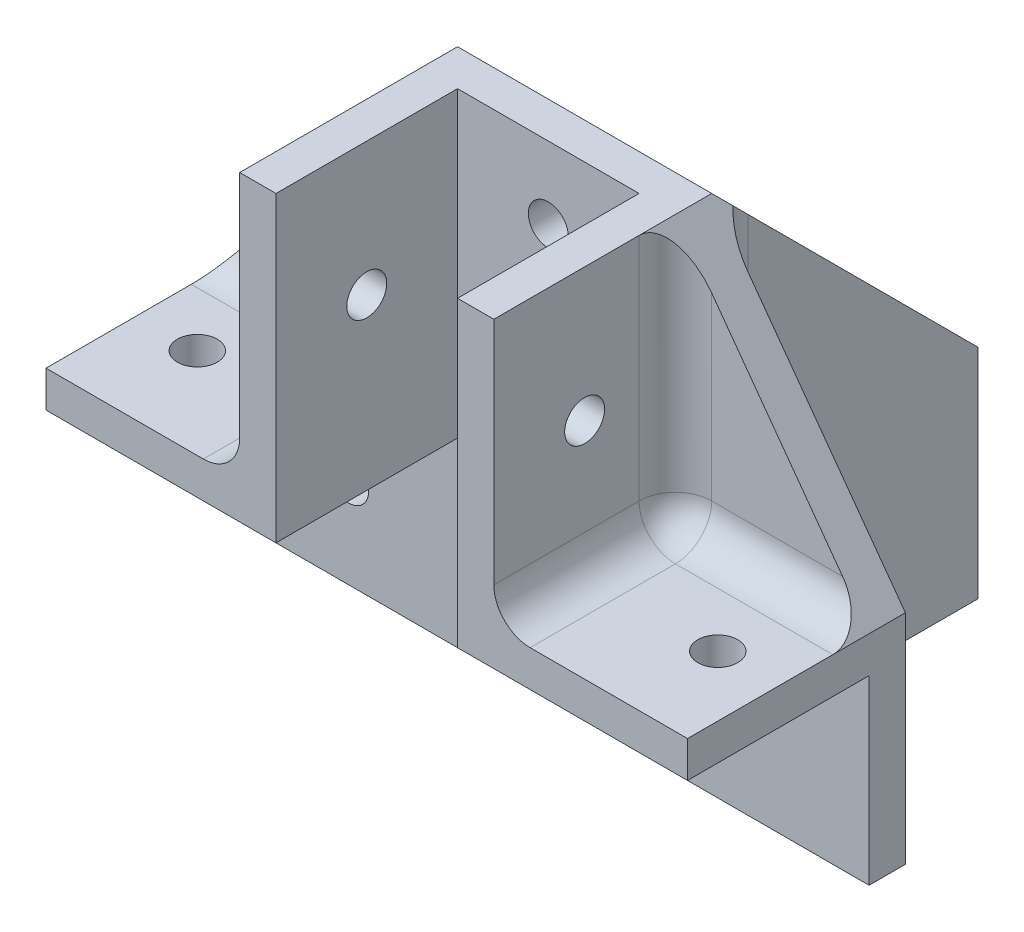
from build123d import *

# Parameters (mm, degrees)
EXTRUDE_1_DEPTH     = 18
SKETCH_2_W          = 21
SKETCH_2_H          = 18
EXTRUDE_2_DEPTH     = 22
SKETCH_3_W          = 15
SKETCH_3_H          = 15
CUT_EXTRUDE_1_DEPTH = 74.280283842
SKETCH_4_W          = 15
SKETCH_4_H          = 15
CUT_EXTRUDE_2_DEPTH = 58.124863238
SKETCH_5_W          = 15
SKETCH_5_H          = 15
CUT_EXTRUDE_3_DEPTH = 63.467991804
SKETCH_6_R          = 1.65
CUT_EXTRUDE_4_DEPTH = 53.784941034
SKETCH_7_R          = 1.65
CUT_EXTRUDE_5_DEPTH = 47.338428976
SKETCH_8_R          = 1.65
CUT_EXTRUDE_6_DEPTH = 63.689712075
EXTRUDE_4_DEPTH     = 3
EXTRUDE_5_DEPTH     = 3
EXTRUDE_6_DEPTH     = 3
FILLET_1_R          = 3


with BuildPart() as part:
    # 草图1 → 凸台-拉伸1 (new body)
    with BuildSketch(Plane(origin=(0, 0, 0), x_dir=(1, 0, 0), z_dir=(0, 1, 0))):
        Polygon((10.5, 9), (26.5, 9), (26.5, -9), (-26.5, -9), (-26.5, 9), (-10.5, 9), (-10.5, 31), (10.5, 31), align=None)
    extrude(amount=EXTRUDE_1_DEPTH)

    # 草图2 → 凸台-拉伸2 (add)
    with BuildSketch(Plane(origin=(0, 18, 0), x_dir=(1, 0, 0), z_dir=(0, 1, 0))):
        Rectangle(SKETCH_2_W, SKETCH_2_H)
    extrude(amount=EXTRUDE_2_DEPTH)

    # 草图3 → 切除-拉伸1 (cut, through all)
    with BuildSketch(Plane.ZY.offset(26.5)):
        with Locations((1.5, 7.5)):
            Rectangle(SKETCH_3_W, SKETCH_3_H)
    extrude(amount=-CUT_EXTRUDE_1_DEPTH, mode=Mode.SUBTRACT)

    # 草图4 → 切除-拉伸2 (cut, through all)
    with BuildSketch(Plane(origin=(0, 40, 0), x_dir=(1, 0, 0), z_dir=(0, 1, 0))):
        with Locations((0, -1.5)):
            Rectangle(SKETCH_4_W, SKETCH_4_H)
    extrude(amount=-CUT_EXTRUDE_2_DEPTH, mode=Mode.SUBTRACT)

    # 草图5 → 切除-拉伸3 (cut, through all)
    with BuildSketch(Plane(origin=(0, 0, -31), x_dir=(-1, 0, 0), z_dir=(0, 0, -1))):
        with Locations((0, 7.5)):
            Rectangle(SKETCH_5_W, SKETCH_5_H)
    extrude(amount=-CUT_EXTRUDE_3_DEPTH, mode=Mode.SUBTRACT)

    # 草图6 → 切除-拉伸4 (cut, through all)
    with BuildSketch(Plane(origin=(0, 0, -9), x_dir=(-1, 0, 0), z_dir=(0, 0, -1))):
        with Locations((-16.5, 7.5)):
            Circle(SKETCH_6_R)
        with Locations((0, 24)):
            Circle(SKETCH_6_R)
        with Locations((16.5, 7.5)):
            Circle(SKETCH_6_R)
        with Locations((0, 34)):
            Circle(SKETCH_6_R)
    extrude(amount=-CUT_EXTRUDE_4_DEPTH, mode=Mode.SUBTRACT)

    # 草图7 → 切除-拉伸5 (cut, through all)
    with BuildSketch(Plane(origin=(0, 18, 0), x_dir=(1, 0, 0), z_dir=(0, 1, 0))):
        with Locations(Location((-21.5, -1.5, 0), (0, 0, 270))):
            Circle(SKETCH_7_R)
        with Locations(Location((0, 15, 0), (0, 0, 270))):
            Circle(SKETCH_7_R)
        with Locations(Location((0, 25, 0), (0, 0, 270))):
            Circle(SKETCH_7_R)
        with Locations(Location((21.5, -1.5, 0), (0, 0, 270))):
            Circle(SKETCH_7_R)
    extrude(amount=-CUT_EXTRUDE_5_DEPTH, mode=Mode.SUBTRACT)

    # 草图8 → 切除-拉伸6 (cut, through all)
    with BuildSketch(Plane(origin=(10.5, 0, 0), x_dir=(0, 0, -1), z_dir=(1, 0, 0))):
        with Locations((-1.5, 29)):
            Circle(SKETCH_8_R)
        with Locations((20, 7.5)):
            Circle(SKETCH_8_R)
    extrude(amount=-CUT_EXTRUDE_6_DEPTH, mode=Mode.SUBTRACT)

    # 草图9 → 凸台-拉伸4 (add)
    with BuildSketch(Plane(origin=(0, 0, -9), x_dir=(-1, 0, 0), z_dir=(0, 0, -1))):
        Polygon((-10.5, 40), (-26.5, 18), (-10.5, 18), align=None)
        Polygon((10.5, 40), (26.5, 18), (10.5, 18), align=None)
    extrude(amount=-EXTRUDE_4_DEPTH)

    # 草图10 → 凸台-拉伸5 (add)
    with BuildSketch(Plane(origin=(10.5, 0, 0), x_dir=(0, 0, -1), z_dir=(1, 0, 0))):
        Polygon((9, 40), (31, 18), (9, 18), align=None)
    extrude(amount=-EXTRUDE_5_DEPTH)

    # 草图11 → 凸台-拉伸6 (add)
    with BuildSketch(Plane.ZY.offset(10.5)):
        Polygon((-9, 40), (-31, 18), (-9, 18), align=None)
    extrude(amount=-EXTRUDE_6_DEPTH)

    # 圆角1
    # the kernel refuses this fillet: 3 mm, written as the material it adds along each edge
    with BuildSketch(Plane(origin=(-13.5, 21, -3), x_dir=(0, -1, 0), z_dir=(1, 0, 0))) as fillet_1_piece_1_section:
        Polygon((0, 0), (FILLET_1_R, 0), (FILLET_1_R, FILLET_1_R), (0, FILLET_1_R), align=None)
    fillet_1_piece_1 = extrude(amount=FILLET_1_R, mode=Mode.PRIVATE)
    fillet_1_piece_1 = fillet_1_piece_1 - Plane(origin=(-13.5, 21, -3), x_dir=(0, 0.7071067811865475, 0.7071067811865475), z_dir=(1, 0, 0)) * Sphere(FILLET_1_R, mode=Mode.PRIVATE)
    add(fillet_1_piece_1)
    with BuildSketch(Plane(origin=(13.5, 21, -3), x_dir=(0, -1, 0), z_dir=(0, 0, -1))) as fillet_1_piece_2_section:
        Polygon((0, 0), (FILLET_1_R, 0), (FILLET_1_R, FILLET_1_R), (0, FILLET_1_R), align=None)
    fillet_1_piece_2 = extrude(amount=FILLET_1_R, mode=Mode.PRIVATE)
    fillet_1_piece_2 = fillet_1_piece_2 - Plane(origin=(13.5, 21, -3), x_dir=(0.7071067811865475, 0.7071067811865475, 0), z_dir=(0, 0, -1)) * Sphere(FILLET_1_R, mode=Mode.PRIVATE)
    add(fillet_1_piece_2)
    with BuildSketch(Plane(origin=(-4.5, 21, -12), x_dir=(-1, 0, 0), z_dir=(0, 0, 1))) as fillet_1_piece_3_section:
        Polygon((0, 0), (FILLET_1_R, 0), (FILLET_1_R, FILLET_1_R), (0, FILLET_1_R), align=None)
    fillet_1_piece_3 = extrude(amount=FILLET_1_R, mode=Mode.PRIVATE)
    fillet_1_piece_3 = fillet_1_piece_3 - Plane(origin=(-4.5, 21, -12), x_dir=(0.7071067811865475, 0.7071067811865475, 0), z_dir=(0, 0, 1)) * Sphere(FILLET_1_R, mode=Mode.PRIVATE)
    add(fillet_1_piece_3)
    with BuildSketch(Plane(origin=(4.5, 21, -12), x_dir=(0, 0, 1), z_dir=(1, 0, 0))) as fillet_1_piece_4_section:
        Polygon((0, 0), (FILLET_1_R, 0), (FILLET_1_R, FILLET_1_R), (0, FILLET_1_R), align=None)
    fillet_1_piece_4 = extrude(amount=FILLET_1_R, mode=Mode.PRIVATE)
    fillet_1_piece_4 = fillet_1_piece_4 - Plane(origin=(4.5, 21, -12), x_dir=(0, 0.7071067811865475, -0.7071067811865475), z_dir=(1, 0, 0)) * Sphere(FILLET_1_R, mode=Mode.PRIVATE)
    add(fillet_1_piece_4)
    with BuildSketch(Plane(origin=(-10.5, 18, 9), x_dir=(-1, 0, 0), z_dir=(0, 0, -1))) as fillet_1_piece_5:
        with BuildLine():
            CenterArc((FILLET_1_R, FILLET_1_R), FILLET_1_R, 180, 90)
            Line((0, FILLET_1_R), (0, 0))
            Line((0, 0), (FILLET_1_R, 0))
        make_face()
    extrude(amount=12)
    with BuildSketch(Plane(origin=(10.5, 21, -6), x_dir=(0, 0, 1), z_dir=(0, 1, 0))) as fillet_1_piece_6_section:
        with BuildLine():
            CenterArc((FILLET_1_R, FILLET_1_R), FILLET_1_R, 180, 90)
            Line((0, FILLET_1_R), (0, 0))
            Line((0, 0), (FILLET_1_R, 0))
        make_face()
    fillet_1_piece_6 = extrude(amount=19, mode=Mode.PRIVATE)
    fillet_1_piece_6 = split(fillet_1_piece_6, bisect_by=Plane(origin=(15.455477793, 33.186218035, -5.302148296), z_dir=(-0.8087360843031884, -0.5881716976750465, 0)), keep=Keep.TOP, mode=Mode.PRIVATE)
    add(fillet_1_piece_6)
    with BuildSketch(Plane(origin=(26.5, 18, -6), x_dir=(0, 1, 0), z_dir=(-1, 0, 0))) as fillet_1_piece_7_section:
        with BuildLine():
            CenterArc((FILLET_1_R, -FILLET_1_R), FILLET_1_R, 90, 90)
            Line((0, -FILLET_1_R), (0, 0))
            Line((0, 0), (FILLET_1_R, 0))
        make_face()
    fillet_1_piece_7 = extrude(amount=13, mode=Mode.PRIVATE)
    fillet_1_piece_7 = split(fillet_1_piece_7, bisect_by=Plane(origin=(23.857097581, 21.633990826, -5.306552659), z_dir=(-0.8087360843031884, -0.5881716976750465, 0)), keep=Keep.TOP, mode=Mode.PRIVATE)
    add(fillet_1_piece_7)
    with BuildSketch(Plane(origin=(-10.5, 0, -9), x_dir=(0, 0, -1), z_dir=(0, 1, 0))) as fillet_1_piece_8_section:
        with BuildLine():
            CenterArc((FILLET_1_R, FILLET_1_R), FILLET_1_R, 180, 90)
            Line((0, FILLET_1_R), (0, 0))
            Line((0, 0), (FILLET_1_R, 0))
        make_face()
    fillet_1_piece_8 = extrude(amount=47.5, mode=Mode.PRIVATE)
    fillet_1_piece_8 = split(fillet_1_piece_8, bisect_by=Plane(origin=(-11.170543691, 29.3263589, -19.6736411), z_dir=(0, -0.7071067811865478, 0.7071067811865474)), keep=Keep.TOP, mode=Mode.PRIVATE)
    fillet_1_piece_8 = split(fillet_1_piece_8, bisect_by=Plane(origin=(-20.564055467, 26.161923732, -9.677561004), z_dir=(0.8087360843031883, -0.5881716976750465, 0)), keep=Keep.TOP, mode=Mode.PRIVATE)
    add(fillet_1_piece_8)
    with BuildSketch(Plane(origin=(10.5, 0, -9), x_dir=(1, 0, 0), z_dir=(0, 1, 0))) as fillet_1_piece_9_section:
        with BuildLine():
            CenterArc((FILLET_1_R, FILLET_1_R), FILLET_1_R, 180, 90)
            Line((0, FILLET_1_R), (0, 0))
            Line((0, 0), (FILLET_1_R, 0))
        make_face()
    fillet_1_piece_9 = extrude(amount=47.5, mode=Mode.PRIVATE)
    fillet_1_piece_9 = split(fillet_1_piece_9, bisect_by=Plane(origin=(20.564055468, 26.161923731, -9.677561004), z_dir=(-0.8087360843031884, -0.5881716976750465, 0)), keep=Keep.TOP, mode=Mode.PRIVATE)
    fillet_1_piece_9 = split(fillet_1_piece_9, bisect_by=Plane(origin=(11.170543691, 29.326358899, -19.673641101), z_dir=(0, -0.7071067811865478, 0.7071067811865474)), keep=Keep.TOP, mode=Mode.PRIVATE)
    add(fillet_1_piece_9)
    with BuildSketch(Plane(origin=(-10.5, 21, -6), x_dir=(-1, 0, 0), z_dir=(0, 1, 0))) as fillet_1_piece_10_section:
        with BuildLine():
            CenterArc((FILLET_1_R, FILLET_1_R), FILLET_1_R, 180, 90)
            Line((0, FILLET_1_R), (0, 0))
            Line((0, 0), (FILLET_1_R, 0))
        make_face()
    fillet_1_piece_10 = extrude(amount=19, mode=Mode.PRIVATE)
    fillet_1_piece_10 = split(fillet_1_piece_10, bisect_by=Plane(origin=(-15.455477793, 33.186218035, -5.302148296), z_dir=(0.8087360843031883, -0.5881716976750465, 0)), keep=Keep.TOP, mode=Mode.PRIVATE)
    add(fillet_1_piece_10)
    with BuildSketch(Plane(origin=(-26.5, 18, -6), x_dir=(0, 0, 1), z_dir=(1, 0, 0))) as fillet_1_piece_11_section:
        with BuildLine():
            CenterArc((FILLET_1_R, -FILLET_1_R), FILLET_1_R, 90, 90)
            Line((0, -FILLET_1_R), (0, 0))
            Line((0, 0), (FILLET_1_R, 0))
        make_face()
    fillet_1_piece_11 = extrude(amount=13, mode=Mode.PRIVATE)
    fillet_1_piece_11 = split(fillet_1_piece_11, bisect_by=Plane(origin=(-23.857097581, 21.633990826, -5.306552659), z_dir=(0.8087360843031883, -0.5881716976750465, 0)), keep=Keep.TOP, mode=Mode.PRIVATE)
    add(fillet_1_piece_11)
    with BuildSketch(Plane(origin=(-4.5, 18, -9), x_dir=(0, 0, -1), z_dir=(1, 0, 0))) as fillet_1_piece_12:
        with BuildLine():
            CenterArc((FILLET_1_R, FILLET_1_R), FILLET_1_R, 180, 90)
            Line((0, FILLET_1_R), (0, 0))
            Line((0, 0), (FILLET_1_R, 0))
        make_face()
    extrude(amount=9)
    with BuildSketch(Plane(origin=(7.5, 21, -9), x_dir=(0, 0, -1), z_dir=(0, 1, 0))) as fillet_1_piece_13_section:
        with BuildLine():
            CenterArc((FILLET_1_R, FILLET_1_R), FILLET_1_R, 180, 90)
            Line((0, FILLET_1_R), (0, 0))
            Line((0, 0), (FILLET_1_R, 0))
        make_face()
    fillet_1_piece_13 = extrude(amount=19, mode=Mode.PRIVATE)
    fillet_1_piece_13 = split(fillet_1_piece_13, bisect_by=Plane(origin=(6.80742854, 34.757043793, -14.242956207), z_dir=(0, -0.7071067811865478, 0.7071067811865474)), keep=Keep.TOP, mode=Mode.PRIVATE)
    add(fillet_1_piece_13)
    with BuildSketch(Plane(origin=(7.5, 18, -31), x_dir=(-1, 0, 0), z_dir=(0, 0, 1))) as fillet_1_piece_14_section:
        with BuildLine():
            CenterArc((FILLET_1_R, -FILLET_1_R), FILLET_1_R, 90, 90)
            Line((0, -FILLET_1_R), (0, 0))
            Line((0, 0), (FILLET_1_R, 0))
        make_face()
    fillet_1_piece_14 = extrude(amount=19, mode=Mode.PRIVATE)
    fillet_1_piece_14 = split(fillet_1_piece_14, bisect_by=Plane(origin=(6.80742854, 23.242956207, -25.757043793), z_dir=(0, -0.7071067811865478, 0.7071067811865474)), keep=Keep.TOP, mode=Mode.PRIVATE)
    add(fillet_1_piece_14)
    with BuildSketch(Plane(origin=(-7.5, 21, -9), x_dir=(1, 0, 0), z_dir=(0, 1, 0))) as fillet_1_piece_15_section:
        with BuildLine():
            CenterArc((FILLET_1_R, FILLET_1_R), FILLET_1_R, 180, 90)
            Line((0, FILLET_1_R), (0, 0))
            Line((0, 0), (FILLET_1_R, 0))
        make_face()
    fillet_1_piece_15 = extrude(amount=19, mode=Mode.PRIVATE)
    fillet_1_piece_15 = split(fillet_1_piece_15, bisect_by=Plane(origin=(-6.80742854, 34.757043793, -14.242956207), z_dir=(0, -0.7071067811865478, 0.7071067811865474)), keep=Keep.TOP, mode=Mode.PRIVATE)
    add(fillet_1_piece_15)
    with BuildSketch(Plane(origin=(-7.5, 18, -31), x_dir=(1, 0, 0), z_dir=(0, 0, 1))) as fillet_1_piece_16_section:
        with BuildLine():
            CenterArc((FILLET_1_R, FILLET_1_R), FILLET_1_R, 180, 90)
            Line((0, FILLET_1_R), (0, 0))
            Line((0, 0), (FILLET_1_R, 0))
        make_face()
    fillet_1_piece_16 = extrude(amount=19, mode=Mode.PRIVATE)
    fillet_1_piece_16 = split(fillet_1_piece_16, bisect_by=Plane(origin=(-6.80742854, 23.242956207, -25.757043793), z_dir=(0, -0.7071067811865478, 0.7071067811865474)), keep=Keep.TOP, mode=Mode.PRIVATE)
    add(fillet_1_piece_16)
    with BuildSketch(Plane(origin=(10.5, 18, -3), x_dir=(0, 1, 0), z_dir=(0, 0, 1))) as fillet_1_piece_17:
        with BuildLine():
            CenterArc((FILLET_1_R, -FILLET_1_R), FILLET_1_R, 90, 90)
            Line((0, -FILLET_1_R), (0, 0))
            Line((0, 0), (FILLET_1_R, 0))
        make_face()
    extrude(amount=12)


solid = part.part
